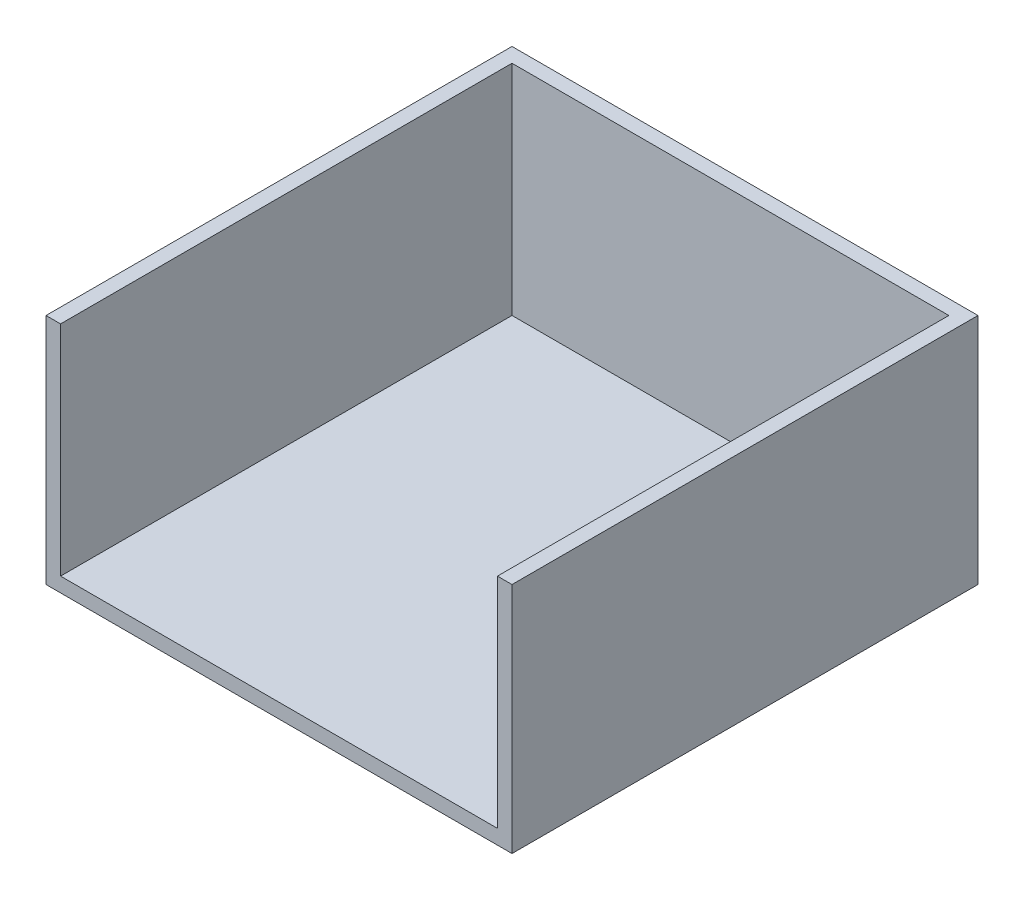
from build123d import *

# Parameters (mm, degrees)
SKETCH1_W           = 304.8
SKETCH1_H           = 152.4
BOSS_EXTRUDE1_DEPTH = 304.8
SHELL1_T            = -9.525


with BuildPart() as part:
    # Sketch1 → Boss-Extrude1 (new body)
    with BuildSketch(Plane.XY):
        Rectangle(SKETCH1_W, SKETCH1_H)
    extrude(amount=BOSS_EXTRUDE1_DEPTH)

    # Shell1
    shell1_openings = [part.faces().sort_by_distance(p)[0] for p in [
        (0, 0, 304.8),
        (0, 76.2, 152.4),
    ]]
    offset(amount=SHELL1_T, openings=shell1_openings, kind=Kind.INTERSECTION)


solid = part.part
